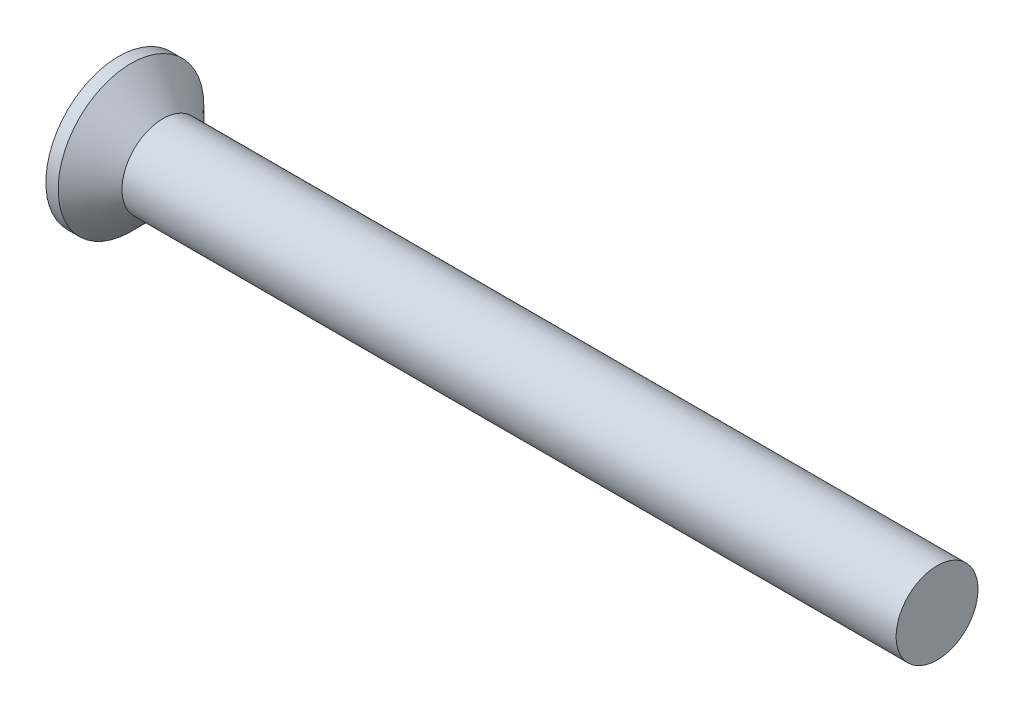
from build123d import *

# Parameters (mm, degrees)
CROSSRECESS_DEPTH = 1.35
DRAFT9_ANGLE      = 30
FILLET5_R         = 0.3
SKETCH10_W        = 0.8
SKETCH10_H        = 2.5


with BuildPart() as part:
    # Sketch1 → Base (revolve)
    with BuildSketch(Plane.XY):
        Polygon((50, 2.5), (4.3, 2.5), (2.7, 2.5), (0.75, 4.45), (0, 4.45), (0, 0), (50, 0), align=None)
    revolve(axis=Axis((4.515812911, 0, 0), (-1, 0, 0)))

    # Sketch6 → CrossRecess (cut)
    with BuildSketch(Plane(origin=(0, 0, 0), x_dir=(0, 0, -1), z_dir=(1, 0, 0))):
        Polygon((0.52, 0.52), (0.52, 2.6), (-0.52, 2.6), (-0.52, 0.52), (-2.6, 0.52), (-2.6, -0.52), (-0.52, -0.52), (-0.52, -2.6), (0.52, -2.6), (0.52, -0.52), (2.6, -0.52), (2.6, 0.52), align=None)
    extrude(amount=CROSSRECESS_DEPTH, mode=Mode.SUBTRACT)

    # Draft9
    draft9_faces = [part.faces().sort_by_distance(p)[0] for p in [
        (0.675, -2.6, 0),
        (0.675, 0, 2.6),
        (0.675, 0, -2.6),
        (0.675, 2.6, 0),
    ]]
    draft(draft9_faces, Plane(origin=(0, 4.45, 0), x_dir=(0, 0, -1), z_dir=(-1, 0, 0)), DRAFT9_ANGLE)

    # Fillet5
    fillet5_edges = [part.edges().sort_by_distance(p)[0] for p in [
        (0.675, -0.52, -0.52),
        (0.675, -0.52, 0.52),
        (0.675, 0.52, -0.52),
        (0.675, 0.52, 0.52),
    ]]
    fillet(fillet5_edges, radius=FILLET5_R)

    # Sketch10 → Revolve2 (revolve)
    with BuildSketch(Plane.XY):
        with Locations((3.1, 1.25)):
            Rectangle(SKETCH10_W, SKETCH10_H)
    revolve(axis=Axis((62.228915663, 0, 0), (-1, 0, 0)))


solid = part.part
